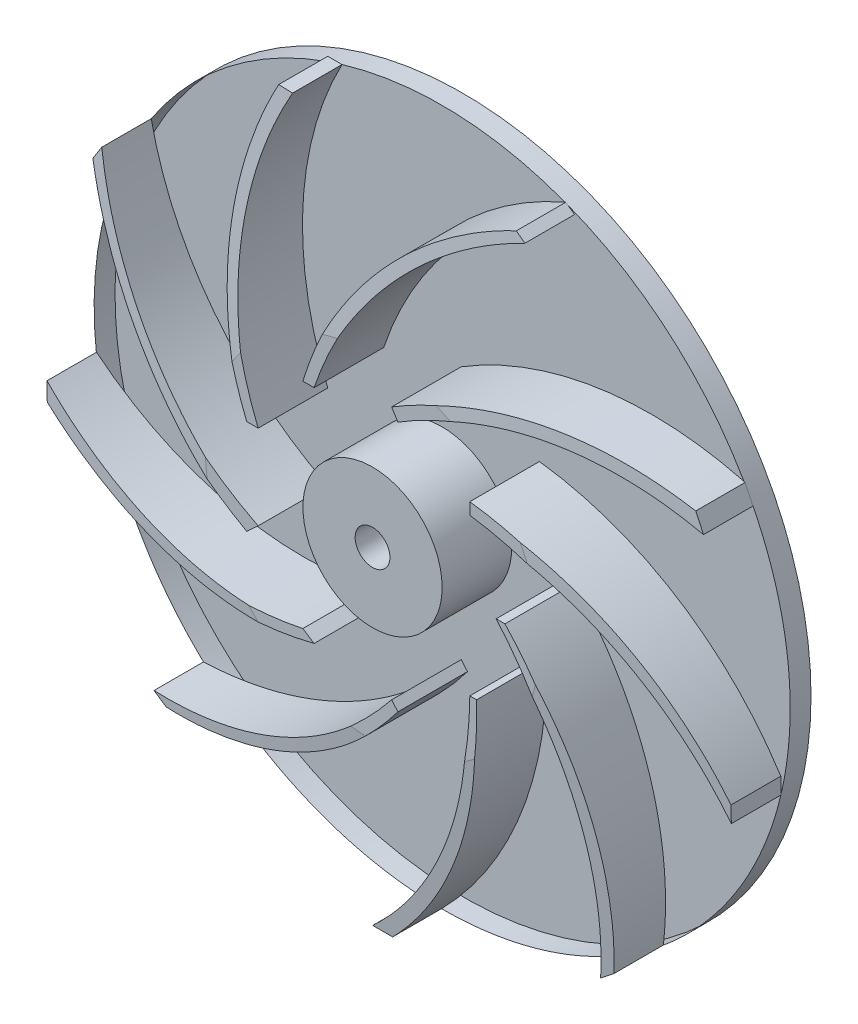
from build123d import *

# Parameters (mm, degrees)
SKETCH1_R           = 50
SKETCH1_R_2         = 2.5
BOSS_EXTRUDE1_DEPTH = 3
SKETCH2_R           = 10
SKETCH2_R_2         = 2.5
BOSS_EXTRUDE2_DEPTH = 10
BOSS_EXTRUDE3_DEPTH = 10


with BuildPart() as part:
    # Sketch1 → Boss-Extrude1 (new body)
    with BuildSketch(Plane.XY):
        Circle(SKETCH1_R)
        Circle(SKETCH1_R_2, mode=Mode.SUBTRACT)
    extrude(amount=BOSS_EXTRUDE1_DEPTH)

    # Sketch2 → Boss-Extrude2 (add)
    with BuildSketch(Plane.XY.offset(3)):
        Circle(SKETCH2_R)
        Circle(SKETCH2_R_2, mode=Mode.SUBTRACT)
    extrude(amount=BOSS_EXTRUDE2_DEPTH)

    # Sketch3 → Boss-Extrude3 (add)
    with BuildSketch(Plane.XY.offset(3)):
        with BuildLine():
            Line((17.7683, 0), (19.0317, 0))
            ThreePointArc((19.0317, 0), (29.643174722, -17.90075179), (31.7807, -38.6003))
            Line((31.7807, -38.6003), (29.8886, -40.0833))
            ThreePointArc((29.8886, -40.0833), (28.126193678, -18.742107729), (17.7683, 0))
        make_face()
        with BuildLine():
            Line((13.9769, 10.9855), (13.9769, 12.6691))
            ThreePointArc((13.9769, 12.6691), (33.750738545, 5.631064154), (48.661, -9.1413))
            Line((48.661, -9.1413), (48.661, -11.4936))
            ThreePointArc((48.661, -11.4936), (33.805363573, 3.582358798), (13.9769, 10.9855))
        make_face()
        with BuildLine():
            Line((3.6456, 17.3996), (2.7447, 18.8413))
            ThreePointArc((2.7447, 18.8413), (22.519917579, 26.046425754), (43.5325, 24.844574103))
            Line((43.5325, 24.844574103), (44.6644, 22.4741))
            ThreePointArc((44.6644, 22.4741), (23.59371422, 24.473901759), (3.6456, 17.3996))
        make_face()
        with BuildLine():
            Line((-8.3916, 15.6722), (-10.0084, 15.6722))
            ThreePointArc((-10.0084, 15.6722), (0.421961039, 34.331036765), (17.7683, 46.823))
            Line((17.7683, 46.823), (19.0317, 45.9259))
            ThreePointArc((19.0317, 45.9259), (2.134812212, 33.686291278), (-8.3916, 15.6722))
        make_face()
        with BuildLine():
            Line((-16.433067229, 6.6116), (-18.0785, 6.6116))
            ThreePointArc((-18.0785, 6.6116), (-21.716511773, 27.427869272), (-16.433067229, 47.8885))
            Line((-16.433067229, 47.8885), (-14.3768, 47.8885))
            ThreePointArc((-14.3768, 47.8885), (-20.005392858, 27.479228392), (-16.433067229, 6.6116))
        make_face()
        with BuildLine():
            Line((-16.433067229, -5.5426), (-18.0785, -7.0437))
            ThreePointArc((-18.0785, -7.0437), (-33.9235925, 6.617771931), (-43.0662, 25.435728775))
            Line((-43.0662, 25.435728775), (-41.7954, 27.4435))
            ThreePointArc((-41.7954, 27.4435), (-32.88257064, 8.053053289), (-16.433067229, -5.5426))
        make_face()
        with BuildLine():
            Line((-10.0084, -15.1034), (-8.3916, -16.1504363))
            ThreePointArc((-8.3916, -16.1504363), (-29.911635768, -16.804077009), (-49.6575, -8.2227))
            Line((-49.6575, -8.2227), (-49.6575, -5.5426))
            ThreePointArc((-49.6575, -5.5426), (-30.921760636, -14.838350366), (-10.0084, -15.1034))
        make_face()
        with BuildLine():
            Line((2.7447, -17.5971), (3.6456, -18.6438))
            ThreePointArc((3.6456, -18.6438), (-12.279975886, -32.191884543), (-32.4952, -37.532228736))
            Line((-32.4952, -37.532228736), (-34.2842, -36.3949))
            ThreePointArc((-34.2842, -36.3949), (-13.722758807, -31.028271447), (2.7447, -17.5971))
        make_face()
        with BuildLine():
            Line((13.9769, -11.4936), (14.9447, -11.4936))
            ThreePointArc((14.9447, -11.4936), (11.410185232, -32.237188752), (0, -49.9176))
            Line((0, -49.9176), (-2.8691, -49.9176))
            ThreePointArc((-2.8691, -49.9176), (9.501237282, -32.436207013), (13.9769, -11.4936))
        make_face()
    extrude(amount=BOSS_EXTRUDE3_DEPTH)

    # Sketch5 → Cut-Revolve2 (revolve, cut)
    with BuildSketch(Plane(origin=(0, 0, 0), x_dir=(1, 0, 0), z_dir=(0, 1, 0))):
        Polygon((24, -13), (51, -10), (51, -20), (24, -20), align=None)
    revolve(axis=Axis((0, 0, 0), (0, 0, 1)), mode=Mode.SUBTRACT)


solid = part.part
